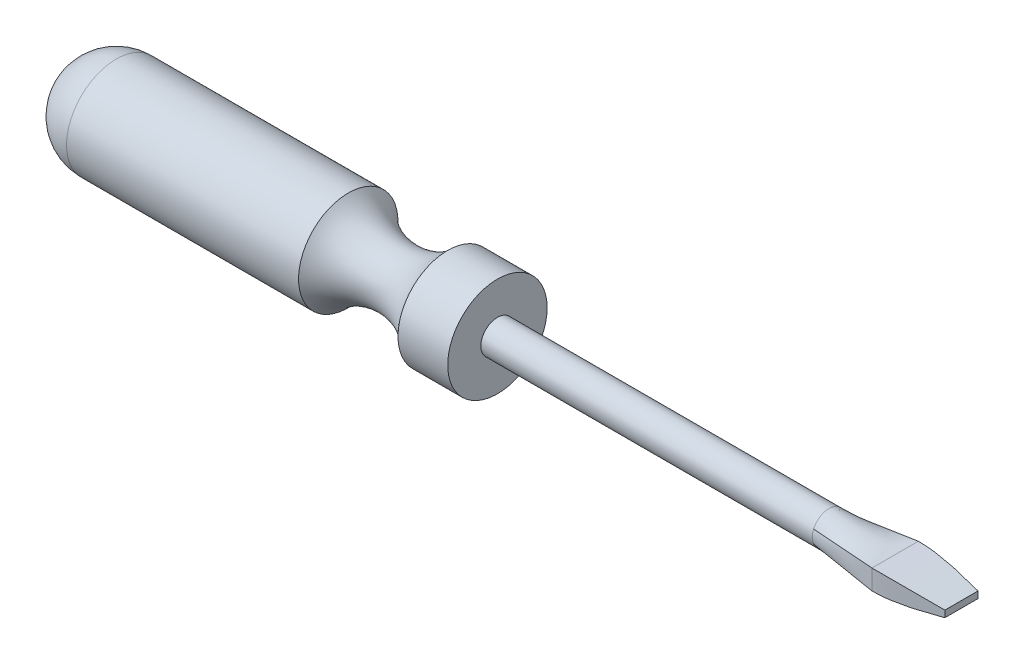
from build123d import *

# Parameters (mm, degrees)
SKETCH6_R           = 6.35
BOSS_EXTRUDE1_DEPTH = 127
LOFT6_START         = -6.35
LOFT6_DEPTH         = 12.6999999
LOFT6_START_2       = -3.8100001
LOFT6_2_DEPTH       = 7.6200001
LOFT6_START_3       = -10
LOFT6_3_DEPTH       = 20


with BuildPart() as part:
    # Sketch3 → Revolve2 (revolve)
    with BuildSketch(Plane(origin=(0, 0, 0), x_dir=(0, 1, 0), z_dir=(0, 0, 1)), mode=Mode.PRIVATE) as revolve2_sk:
        with BuildLine():
            ThreePointArc((19.05, 57.15), (10.450520825, 38.1), (19.05, 19.05))
            Line((19.05, 19.05), (19.05, 0))
            Line((19.05, 0), (0, 0))
            Line((0, 0), (0, 165.1))
            ThreePointArc((0, 165.1), (13.470384182, 159.520384182), (19.05, 146.05))
            Line((19.05, 146.05), (19.05, 57.15))
        make_face()
    revolve(revolve2_sk.sketch.rotate(Axis((0, 0, 0), (-1, 0, 0)), 90), axis=Axis((0, 0, 0), (-1, 0, 0)))

    # Sketch6 → Boss-Extrude1 (add)
    with BuildSketch(Plane.YZ):
        with Locations(Location((0, 0, 0), (0, 0, 270))):
            Circle(SKETCH6_R)
    extrude(amount=BOSS_EXTRUDE1_DEPTH)

    # Sketch7 for Loft5 → Loft5 section 0
    with BuildSketch(Plane(origin=(127, 0, 0), x_dir=(0, 0, -1), z_dir=(1, 0, 0))):
        with BuildLine():
            # circular arc as an exact rational Bezier (weights 1, cos(half-angle), 1)
            Bezier((-5.836570941, 2.501387546), (0, 16.120053073), (5.836570941, 2.501387546), weights=[1, 0.393919299, 1])
            Bezier((5.836570941, 2.501387546), (6.908594174, 0), (5.836570941, -2.501387546), weights=[1, 0.91914503, 1])
            Bezier((5.836570941, -2.501387546), (0, -16.120053073), (-5.836570941, -2.501387546), weights=[1, 0.393919299, 1])
            Bezier((-5.836570941, -2.501387546), (-6.908594174, 0), (-5.836570941, 2.501387546), weights=[1, 0.91914503, 1])
        make_face()
    # Sketch4 → Loft5 section 1
    with BuildSketch(Plane(origin=(152.4, 0, 0), x_dir=(0, 0, -1), z_dir=(1, 0, 0))):
        with BuildLine():
            Line((-8.89, 3.81), (8.89, 3.81))
            Line((8.89, 3.81), (8.89, -3.81))
            Line((8.89, -3.81), (-8.89, -3.81))
            Line((-8.89, -3.81), (-8.89, 3.81))
        make_face()
    loft()

    # Loft6: read off the stored shape, not the designer's step
    # Loft6 outline → Loft6 (add)
    with BuildSketch(Plane.XY.offset(LOFT6_START)):
        with BuildLine():
            Line((177.8, -1.27), (177.8, 1.27))
            add(Edge.make_bspline(
                [(177.8, 1.27), (169.375457091, 2.54), (160.950914181, 3.81), (152.4, 3.81)],
                knots=[0, 0, 0, 0, 1, 1, 1, 1], degree=3))
            Line((152.4, 3.81), (152.4, -3.81))
            add(Edge.make_bspline(
                [(177.8, -1.27), (169.375457091, -2.54), (160.950914181, -3.81), (152.4, -3.81)],
                knots=[0, 0, 0, 0, 1, 1, 1, 1], degree=3))
        make_face()
    extrude(amount=LOFT6_DEPTH)

    # Loft6 2 outline → Loft6 2 (add)
    with BuildSketch(Plane(origin=(0, 0, 0), x_dir=(1, 0, 0), z_dir=(0, 1, 0)).offset(LOFT6_START_2)):
        with BuildLine():
            Line((152.4, 6.35), (177.8, 6.35))
            add(Edge.make_bspline(
                [(177.8, 6.35), (169.375457091, 7.62), (160.950914181, 8.89), (152.4, 8.89)],
                knots=[0, 0, 0, 0, 1, 1, 1, 1], degree=3))
            Line((152.4, 8.89), (152.4, 6.35))
        make_face()
        with BuildLine():
            add(Edge.make_bspline(
                [(177.8, -6.35), (169.375457091, -7.62), (160.950914181, -8.89), (152.4, -8.89)],
                knots=[0, 0, 0, 0, 1, 1, 1, 1], degree=3))
            Line((177.8, -6.35), (152.4, -6.3499999))
            Line((152.4, -6.3499999), (152.4, -8.89))
        make_face()
    extrude(amount=LOFT6_2_DEPTH)

    # Loft6 3 outline → Loft6 3 (cut)
    with BuildSketch(Plane.XY.offset(LOFT6_START_3)):
        with BuildLine():
            add(Edge.make_bspline(
                [(177.8, 1.27), (169.375457091, 2.54), (160.950914181, 3.81), (152.4, 3.81)],
                knots=[0, 0, 0, 0, 1, 1, 1, 1], degree=3))
            Line((177.8, 1.27), (177.8, 3.81))
            Line((177.8, 3.81), (152.4, 3.81))
        make_face()
        with BuildLine():
            add(Edge.make_bspline(
                [(177.8, -1.27), (169.375457091, -2.54), (160.950914181, -3.81), (152.4, -3.81)],
                knots=[0, 0, 0, 0, 1, 1, 1, 1], degree=3))
            Line((152.4, -3.81), (177.8, -3.8100001))
            Line((177.8, -3.8100001), (177.8, -1.27))
        make_face()
    extrude(amount=LOFT6_3_DEPTH, mode=Mode.SUBTRACT)


solid = part.part
